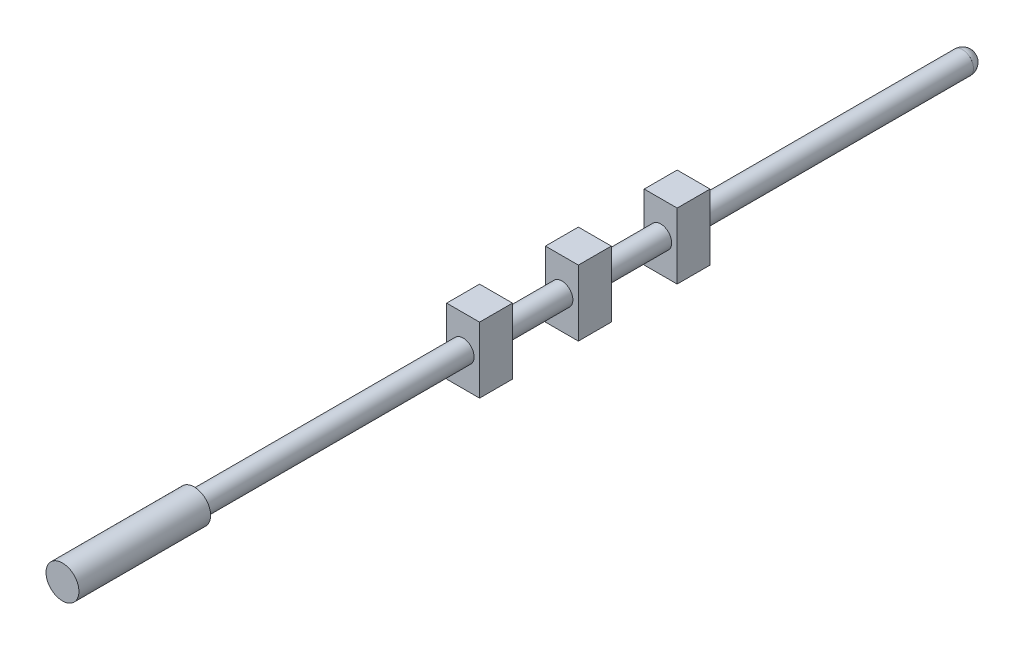
from build123d import *

# Parameters (mm, degrees)
SKETCH1_R           = 25.4
BOSS_EXTRUDE1_DEPTH = 1778
SKETCH2_R           = 38.1
BOSS_EXTRUDE2_DEPTH = 304.8
SKETCH4_W           = 76.2
SKETCH4_H           = 76.2
BOSS_EXTRUDE4_DEPTH = 76.2
SKETCH5_R           = 25.4
BOSS_EXTRUDE5_DEPTH = 25.4
FILLET1_R           = 25.4


with BuildPart() as part:
    # Sketch1 → Boss-Extrude1 (new body)
    with BuildSketch(Plane.XY):
        Circle(SKETCH1_R)
    extrude(amount=BOSS_EXTRUDE1_DEPTH)

    # Sketch2 → Boss-Extrude2 (add)
    with BuildSketch(Plane.XY.offset(1778)):
        with Locations(Location((0, 0, 0), (0, 0, 180))):
            Circle(SKETCH2_R)
    extrude(amount=BOSS_EXTRUDE2_DEPTH)

    # Sketch4 → Boss-Extrude4 (add, symmetric)
    with BuildSketch(Plane(origin=(0, 0, 0), x_dir=(1, 0, 0), z_dir=(0, 1, 0))):
        with Locations((0, -889)):
            Rectangle(SKETCH4_W, SKETCH4_H)
        with Locations((0, -1117.6)):
            Rectangle(SKETCH4_W, SKETCH4_H)
        with Locations((0, -660.4)):
            Rectangle(SKETCH4_W, SKETCH4_H)
    extrude(amount=BOSS_EXTRUDE4_DEPTH, both=True)


with BuildPart() as body_2:
    # Sketch5 → Boss-Extrude5 (new body)
    with BuildSketch(Plane(origin=(0, 0, 0), x_dir=(-1, 0, 0), z_dir=(0, 0, -1))):
        Circle(SKETCH5_R)
    extrude(amount=BOSS_EXTRUDE5_DEPTH)

    # Fillet1
    fillet1_edges = [body_2.edges().sort_by_distance(p)[0] for p in [
        (25.4, 0, -25.4),
    ]]
    fillet(fillet1_edges, radius=FILLET1_R - 0.0001)  # a hair under: the kernel refuses the full size


solid = Compound([part.part, body_2.part])
